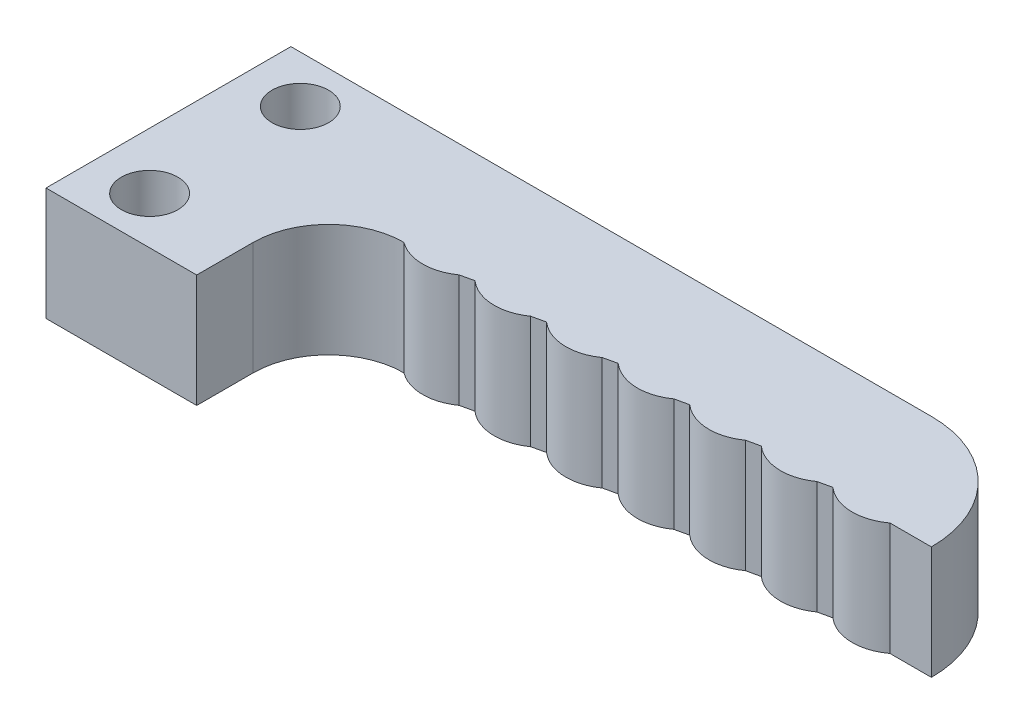
from build123d import *

# Parameters (mm, degrees)
BOSS_EXTRUDE1_DEPTH = 6
SKETCH2_R           = 1.5
CUT_EXTRUDE1_DEPTH  = 22.868927729


with BuildPart() as part:
    # Sketch1 → Boss-Extrude1 (new body)
    with BuildSketch(Plane.XZ):
        with BuildLine():
            Line((20, -0.5), (17.8, -0.5))
            ThreePointArc((17.8, -0.5), (16.025787821, -0.015083969), (14.4, -0.875192319))
            ThreePointArc((14.4, -0.875192319), (12.5, 0), (10.6, -0.875192319))
            ThreePointArc((10.6, -0.875192319), (8.7, 0), (6.8, -0.875192319))
            ThreePointArc((6.8, -0.875192319), (4.9, 0), (3, -0.875192319))
            ThreePointArc((3, -0.875192319), (1.1, 0), (-0.8, -0.875192319))
            ThreePointArc((-0.8, -0.875192319), (-2.7, 0), (-4.6, -0.875192319))
            ThreePointArc((-4.6, -0.875192319), (-6.225787821, -0.015083969), (-8, -0.5))
            ThreePointArc((-8, -0.5), (-10.828427125, 0.671572875), (-12, 3.5))
            Line((-12, 3.5), (-12, 6.5))
            Line((-12, 6.5), (-20, 6.5))
            Line((-20, 6.5), (-20, -6.5))
            Line((-20, -6.5), (14, -6.5))
            ThreePointArc((14, -6.5), (18.242640687, -4.742640687), (20, -0.5))
        make_face()
    extrude(amount=-BOSS_EXTRUDE1_DEPTH)

    # Chamfer1
    # the kernel refuses this chamfer: 0.5, 0.339586842 mm, written as the material it adds along each edge
    with BuildSketch(Plane(origin=(-4.6, 0, -0.875192319), x_dir=(0.7020641169662168, 0, 0.7121137378736954), z_dir=(0, 1, 0)), Plane(origin=(-0.8, 0, -0.875192319), x_dir=(0.7020641169662151, 0, 0.7121137378736971), z_dir=(0, 1, 0)), Plane(origin=(3, 0, -0.875192319), x_dir=(0.7020641169662145, 0, 0.7121137378736978), z_dir=(0, 1, 0)), Plane(origin=(6.8, 0, -0.875192319), x_dir=(0.7020641169662162, 0, 0.712113737873696), z_dir=(0, 1, 0)), Plane(origin=(10.6, 0, -0.875192319), x_dir=(0.7020641169662151, 0, 0.7121137378736971), z_dir=(0, 1, 0)), Plane(origin=(14.4, 0, -0.875192319), x_dir=(0.702064116966188, 0, 0.7121137378737239), z_dir=(0, 1, 0))) as chamfer1_piece_1:
        with BuildLine():
            Line((0.353747902, 0), (-0.021236492, -0.600134418))
            ThreePointArc((-0.021236492, -0.600134418), (0.007142061, -0.309444564), (0, 0))
            ThreePointArc((0, 0), (0.182204356, -0.006259046), (0.353747902, 0))
        make_face()
    extrude(amount=6)

    # Sketch2 → Cut-Extrude1 (cut, through all)
    with BuildSketch(Plane(origin=(0, 6, 0), x_dir=(1, 0, 0), z_dir=(0, 1, 0))):
        with Locations(Location((-17, 4, 0), (0, 0, 270))):
            Circle(SKETCH2_R)
        with Locations(Location((-17, -4, 0), (0, 0, 270))):
            Circle(SKETCH2_R)
    extrude(amount=-CUT_EXTRUDE1_DEPTH, mode=Mode.SUBTRACT)


solid = part.part
